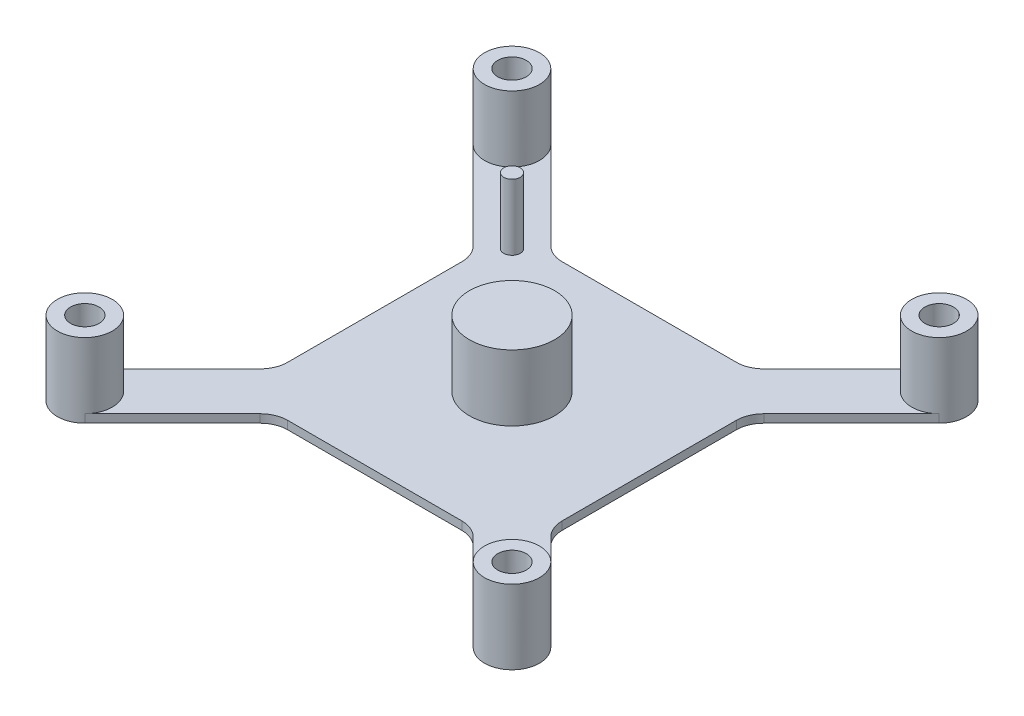
from build123d import *

# Parameters (mm, degrees)
SKETCH1_W           = 50
SKETCH1_H           = 50
SKETCH1_R           = 8
BOSS_EXTRUDE1_DEPTH = 1.5
BOSS_EXTRUDE3_START = -1.5
SKETCH5_R           = 2.6
SKETCH5_R_2         = 8
BOSS_EXTRUDE3_DEPTH = 1.5
FILLET1_R           = 5
SKETCH6_R           = 5
SKETCH6_R_2         = 2.6
BOSS_EXTRUDE4_DEPTH = 12
SKETCH7_R           = 8.25
BOSS_EXTRUDE5_DEPTH = 1.5
SKETCH8_R           = 7.75
BOSS_EXTRUDE6_DEPTH = 12
SKETCH9_R           = 1.5
BOSS_EXTRUDE7_DEPTH = 12


with BuildPart() as part:
    # Sketch1 → Boss-Extrude1 (new body)
    with BuildSketch(Plane(origin=(0, 0, 0), x_dir=(1, 0, 0), z_dir=(0, 1, 0))):
        Rectangle(SKETCH1_W, SKETCH1_H)
        with Locations(Location((0, 0, 0), (0, 0, 270))):
            Circle(SKETCH1_R, mode=Mode.SUBTRACT)
    extrude(amount=BOSS_EXTRUDE1_DEPTH)

    # Sketch5 → Boss-Extrude3 (add)
    with BuildSketch(Plane(origin=(0, 1.5, 0), x_dir=(1, 0, 0), z_dir=(0, 1, 0)).offset(BOSS_EXTRUDE3_START)):
        Polygon((-42.426406871, -35.355339059), (-25, -17.928932188), (-25, 17.928932188), (-42.426406871, 35.355339059), (-45.961940777, 38.890872965), (-38.890872965, 45.961940777), (-35.355339059, 42.426406871), (-17.928932188, 25), (17.928932188, 25), (35.355339059, 42.426406871), (38.890872965, 45.961940777), (45.961940777, 38.890872965), (42.426406871, 35.355339059), (25, 17.928932188), (25, -17.928932188), (42.426406871, -35.355339059), (45.961940777, -38.890872965), (38.890872965, -45.961940777), (35.355339059, -42.426406871), (17.928932188, -25), (-17.928932188, -25), (-35.355339059, -42.426406871), (-38.890872965, -45.961940777), (-45.961940777, -38.890872965), align=None)
        with Locations(Location((-38.890872965, -38.890872965, 0), (0, 0, 270))):
            Circle(SKETCH5_R, mode=Mode.SUBTRACT)
        with Locations(Location((38.890872965, 38.890872965, 0), (0, 0, 270))):
            Circle(SKETCH5_R, mode=Mode.SUBTRACT)
        with Locations(Location((38.890872965, -38.890872965, 0), (0, 0, 90))):
            Circle(SKETCH5_R, mode=Mode.SUBTRACT)
        with Locations(Location((-38.890872965, 38.890872965, 0), (0, 0, 90))):
            Circle(SKETCH5_R, mode=Mode.SUBTRACT)
        with Locations(Location((0, 0, 0), (0, 0, 270))):
            Circle(SKETCH5_R_2, mode=Mode.SUBTRACT)
    extrude(amount=BOSS_EXTRUDE3_DEPTH)

    # Fillet1
    fillet1_edges = [part.edges().sort_by_distance(p)[0] for p in [
        (17.928932188, 0.75, 25),
        (38.890872965, 0.75, 45.961940777),
        (45.961940777, 0.75, 38.890872965),
        (25, 0.75, 17.928932188),
        (25, 0.75, -17.928932188),
        (45.961940777, 0.75, -38.890872965),
        (38.890872965, 0.75, -45.961940777),
        (17.928932188, 0.75, -25),
        (-17.928932188, 0.75, -25),
        (-38.890872965, 0.75, -45.961940777),
        (-45.961940777, 0.75, -38.890872965),
        (-25, 0.75, -17.928932188),
        (-25, 0.75, 17.928932188),
        (-45.961940777, 0.75, 38.890872965),
        (-38.890872965, 0.75, 45.961940777),
        (-17.928932188, 0.75, 25),
    ]]
    fillet(fillet1_edges, radius=FILLET1_R - 0.0001)  # a hair under: the kernel refuses the full size

    # Sketch6 → Boss-Extrude4 (add)
    # profile 1 of 4: a face of its own
    with BuildSketch(Plane(origin=(0, 1.5, 0), x_dir=(1, 0, 0), z_dir=(0, 1, 0))):
        with Locations(Location((-38.890872965, -38.890872965, 0), (0, 0, 270))):
            Circle(SKETCH6_R)
        with Locations(Location((-38.890872965, -38.890872965, 0), (0, 0, 270))):
            Circle(SKETCH6_R_2, mode=Mode.SUBTRACT)
    # profile 2 of 4: a face of its own
    with BuildSketch(Plane(origin=(0, 1.5, 0), x_dir=(1, 0, 0), z_dir=(0, 1, 0))):
        with Locations(Location((-38.890872965, 38.890872965, 0), (0, 0, 270))):
            Circle(SKETCH6_R)
        with Locations(Location((-38.890872965, 38.890872965, 0), (0, 0, 270))):
            Circle(SKETCH6_R_2, mode=Mode.SUBTRACT)
    # profile 3 of 4: a face of its own
    with BuildSketch(Plane(origin=(0, 1.5, 0), x_dir=(1, 0, 0), z_dir=(0, 1, 0))):
        with Locations(Location((38.890872965, 38.890872965, 0), (0, 0, 270))):
            Circle(SKETCH6_R)
        with Locations(Location((38.890872965, 38.890872965, 0), (0, 0, 270))):
            Circle(SKETCH6_R_2, mode=Mode.SUBTRACT)
    # profile 4 of 4: a face of its own
    with BuildSketch(Plane(origin=(0, 1.5, 0), x_dir=(1, 0, 0), z_dir=(0, 1, 0))):
        with Locations(Location((38.890872965, -38.890872965, 0), (0, 0, 270))):
            Circle(SKETCH6_R)
        with Locations(Location((38.890872965, -38.890872965, 0), (0, 0, 270))):
            Circle(SKETCH6_R_2, mode=Mode.SUBTRACT)
    extrude(amount=BOSS_EXTRUDE4_DEPTH)

    # Sketch7 → Boss-Extrude5 (add)
    with BuildSketch(Plane(origin=(0, 1.5, 0), x_dir=(1, 0, 0), z_dir=(0, 1, 0))):
        Circle(SKETCH7_R)
    extrude(amount=-BOSS_EXTRUDE5_DEPTH)

    # Sketch8 → Boss-Extrude6 (add)
    with BuildSketch(Plane(origin=(0, 1.5, 0), x_dir=(1, 0, 0), z_dir=(0, 1, 0))):
        with Locations(Location((0, 0, 0), (0, 0, 90))):
            Circle(SKETCH8_R)
    extrude(amount=BOSS_EXTRUDE6_DEPTH)

    # Sketch9 → Boss-Extrude7 (add)
    with BuildSketch(Plane(origin=(0, 1.5, 0), x_dir=(1, 0, 0), z_dir=(0, 1, 0))):
        with Locations(Location((-22.5, 22.5, 0), (0, 0, 90))):
            Circle(SKETCH9_R)
    extrude(amount=BOSS_EXTRUDE7_DEPTH)


solid = part.part
